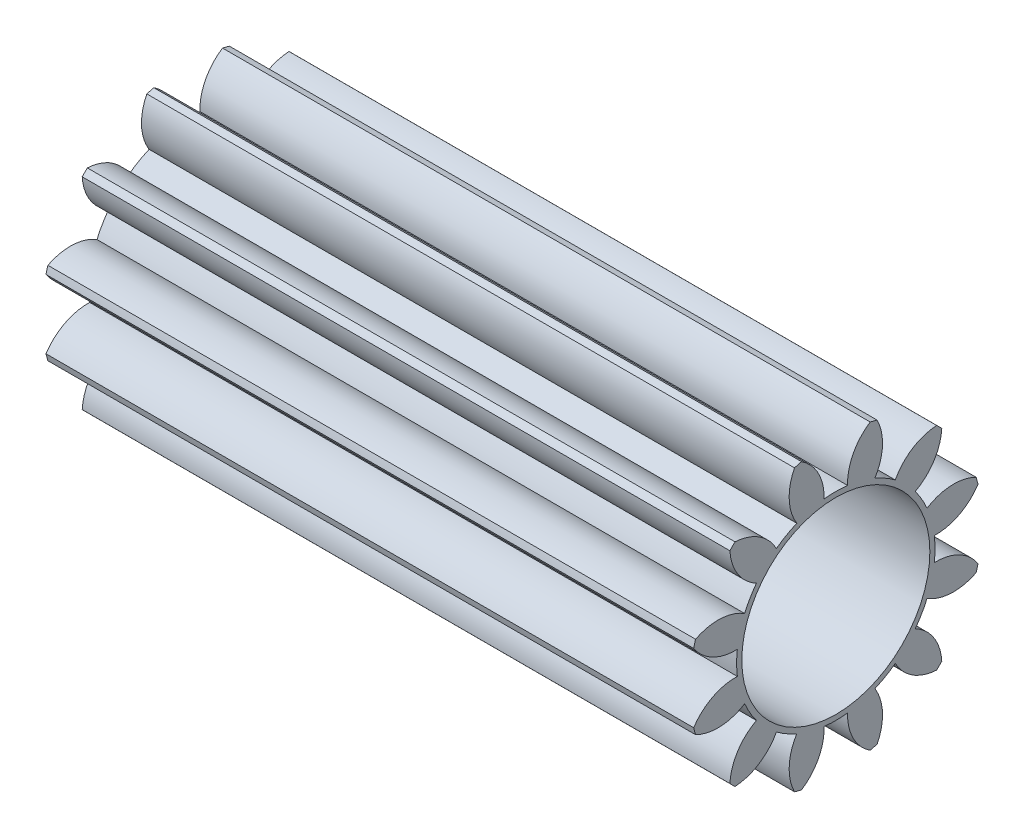
from build123d import *

# Parameters (mm, degrees)
BASPROSKE_W     = 15.5
BASPROSKE_H     = 3.5
TOOTHCUT_DEPTH  = 17.271140095
TEETHCUTS_COUNT = 12
TEETHCUTS_ANGLE = 330
BORSKE_R        = 2.25
BORE_DEPTH      = 50.0000508


with BuildPart() as part:
    # BasProSke → Base-Revolve (revolve)
    with BuildSketch(Plane(origin=(0, 0, 0), x_dir=(1, 0, 0), z_dir=(0, 1, 0))):
        with Locations((7.75, 1.75)):
            Rectangle(BASPROSKE_W, BASPROSKE_H)
    revolve(axis=Axis((-10, 0, 0), (1, 0, 0)))

    # TooCutSke → ToothCut (cut, through all)
    with BuildSketch(Plane(origin=(0, 0, 0), x_dir=(0, 0, -1), z_dir=(1, 0, 0))):
        with BuildLine():
            ThreePointArc((0.281121165, 2.357296522), (0, 2.374), (-0.281121165, 2.357296522))
            ThreePointArc((-0.281121165, 2.357296522), (-0.422795142, 2.966088489), (-0.851415412, 3.421043256))
            ThreePointArc((-0.851415412, 3.421043256), (0, 3.5254), (0.851415412, 3.421043256))
            ThreePointArc((0.851415412, 3.421043256), (0.422795142, 2.966088489), (0.281121165, 2.357296522))
        make_face()
    toothcut = extrude(amount=TOOTHCUT_DEPTH, mode=Mode.SUBTRACT)

    # TeethCuts: ToothCut ×12 about axis
    teethcuts_axis = Axis((-10, 0, 0), (1, 0, 0))
    for i in range(1, TEETHCUTS_COUNT):
        add(toothcut.rotate(teethcuts_axis, i * TEETHCUTS_ANGLE / (TEETHCUTS_COUNT - 1)), mode=Mode.SUBTRACT)

    # BorSke → Bore (cut, symmetric)
    with BuildSketch(Plane(origin=(0, 0, 0), x_dir=(0, 0, -1), z_dir=(1, 0, 0))):
        Circle(BORSKE_R)
    extrude(amount=BORE_DEPTH, both=True, mode=Mode.SUBTRACT)


solid = part.part
